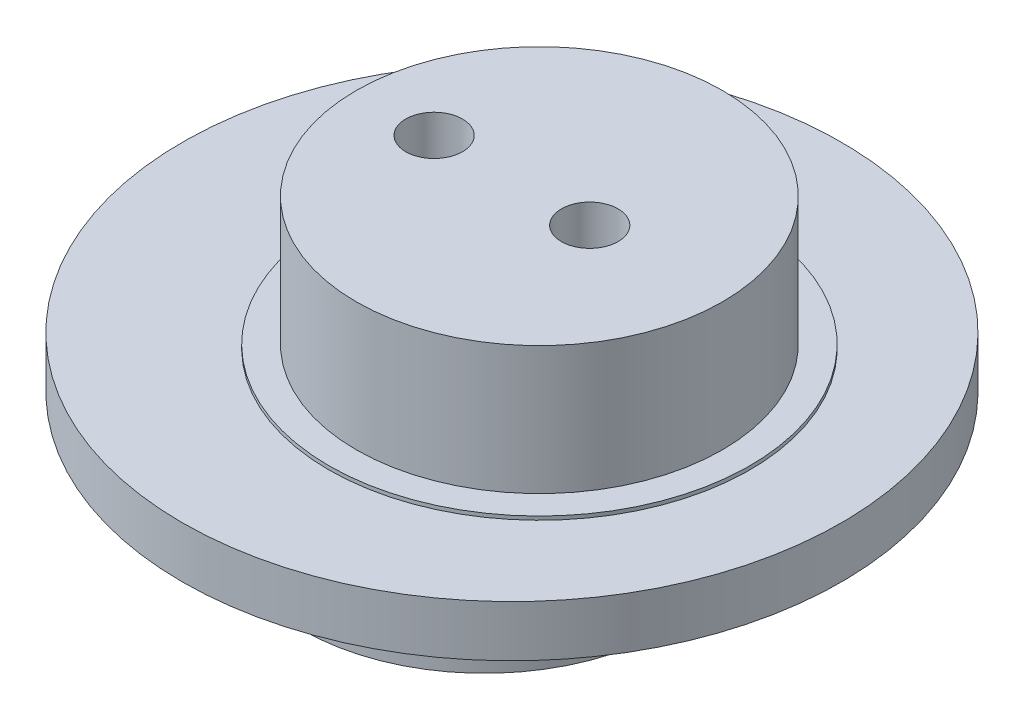
from build123d import *

# Parameters (mm, degrees)
SKIZZE1_R                        = 18
AUFSATZ_LINEAR_AUSTRAGEN1_DEPTH  = 2.8
SKIZZE2_R                        = 11.5
AUFSATZ_LINEAR_AUSTRAGEN2_DEPTH  = 0.2
SKIZZE3_R                        = 10
AUFSATZ_LINEAR_AUSTRAGEN3_DEPTH  = 7
SKIZZE4_R                        = 10
AUFSATZ_LINEAR_AUSTRAGEN4_DEPTH  = 7
F_3_1_3_1_DURCHMESSER_BOHRUNG1_D = 3.1


with BuildPart() as part:
    # Skizze1 → Aufsatz-Linear austragen1 (new body)
    with BuildSketch(Plane(origin=(0, 0, 0), x_dir=(1, 0, 0), z_dir=(0, 1, 0))):
        Circle(SKIZZE1_R)
    extrude(amount=AUFSATZ_LINEAR_AUSTRAGEN1_DEPTH)

    # Skizze2 → Aufsatz-Linear austragen2 (add)
    with BuildSketch(Plane(origin=(0, 2.8, 0), x_dir=(1, 0, 0), z_dir=(0, 1, 0))):
        with Locations((1.5, 0)):
            Circle(SKIZZE2_R)
    extrude(amount=AUFSATZ_LINEAR_AUSTRAGEN2_DEPTH)

    # Skizze3 → Aufsatz-Linear austragen3 (add)
    with BuildSketch(Plane(origin=(0, 3, 0), x_dir=(1, 0, 0), z_dir=(0, 1, 0))):
        with Locations((1.5, 0)):
            Circle(SKIZZE3_R)
    extrude(amount=AUFSATZ_LINEAR_AUSTRAGEN3_DEPTH)

    # Skizze4 → Aufsatz-Linear austragen4 (add)
    with BuildSketch(Plane.XZ):
        with Locations((-1.5, 0)):
            Circle(SKIZZE4_R)
    extrude(amount=AUFSATZ_LINEAR_AUSTRAGEN4_DEPTH)

    # Ø3.1 (3.1) Durchmesser Bohrung1 (through all)
    with Locations(Plane(origin=(0, 10, 0), x_dir=(1, 0, 0), z_dir=(0, 1, 0))):
        with Locations((4.25, 0), (-4.25, 0)):
            Hole(F_3_1_3_1_DURCHMESSER_BOHRUNG1_D / 2)


solid = part.part
